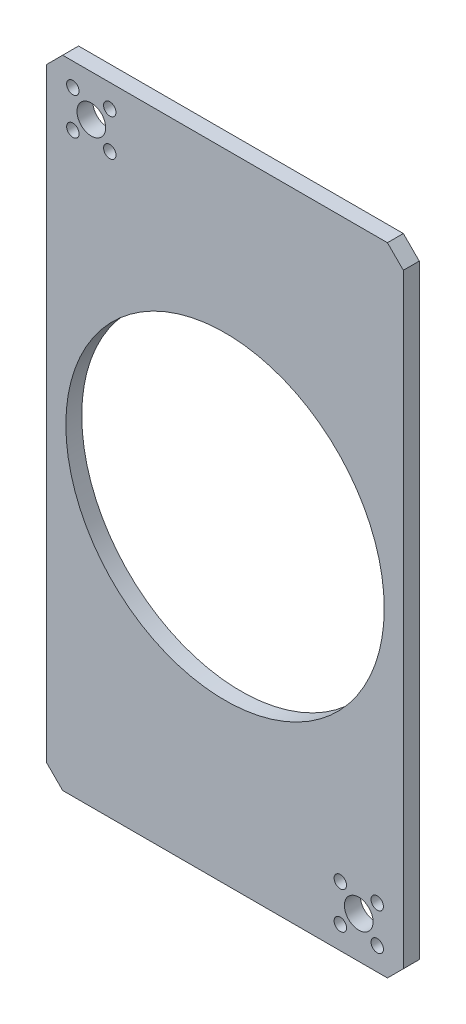
from build123d import *

# Parameters (mm, degrees)
SKETCH1_W               = 112
SKETCH1_H               = 200
BOSS_EXTRUDE1_DEPTH     = 5
SKETCH6_R               = 4.5
SKETCH6_R_2             = 1.95
LEANDUT_HOLES_DEPTH     = 115.721401665
CHAMFER1_SIZE           = 5
SKETCH7_R               = 50
CUT_EXTRUDE3_DEPTH      = 115.721401665
DELETEFACE1_OUTLINE_R   = 1.95
DELETEFACE1_OUTLINE_R_2 = 4.5
DELETEFACE1_DEPTH       = 5


# Read off the part's stored shape, not the designer's step: DeleteFace1
with BuildPart() as part:
    # Sketch1 → Boss-Extrude1 (new body)
    with BuildSketch(Plane.XY):
        Rectangle(SKETCH1_W, SKETCH1_H)
    extrude(amount=BOSS_EXTRUDE1_DEPTH)

    # Sketch6 → Leandut_holes (cut, through all)
    with BuildSketch(Plane.XY.offset(5)):
        with Locations((-42, 87)):
            Circle(SKETCH6_R)
        with Locations((-47.8, 92.8)):
            Circle(SKETCH6_R_2)
        with Locations(Location((-47.8, 81.2, 0), (0, 0, 180))):
            Circle(SKETCH6_R_2)
        with Locations((-36.2, 81.2)):
            Circle(SKETCH6_R_2)
        with Locations(Location((-36.2, 92.8, 0), (0, 0, 180))):
            Circle(SKETCH6_R_2)
        with Locations((36.2, 92.8)):
            Circle(SKETCH6_R_2)
        with Locations(Location((36.2, 81.2, 0), (0, 0, 180))):
            Circle(SKETCH6_R_2)
        with Locations((47.8, 81.2)):
            Circle(SKETCH6_R_2)
        with Locations(Location((47.8, 92.8, 0), (0, 0, 180))):
            Circle(SKETCH6_R_2)
        with Locations(Location((42, 87, 0), (0, 0, 180))):
            Circle(SKETCH6_R)
        with Locations((42, -87)):
            Circle(SKETCH6_R)
        with Locations((47.8, -92.8)):
            Circle(SKETCH6_R_2)
        with Locations(Location((47.8, -81.2, 0), (0, 0, 180))):
            Circle(SKETCH6_R_2)
        with Locations((36.2, -81.2)):
            Circle(SKETCH6_R_2)
        with Locations(Location((36.2, -92.8, 0), (0, 0, 180))):
            Circle(SKETCH6_R_2)
        with Locations((-36.2, -92.8)):
            Circle(SKETCH6_R_2)
        with Locations(Location((-36.2, -81.2, 0), (0, 0, 180))):
            Circle(SKETCH6_R_2)
        with Locations((-47.8, -81.2)):
            Circle(SKETCH6_R_2)
        with Locations(Location((-47.8, -92.8, 0), (0, 0, 180))):
            Circle(SKETCH6_R_2)
        with Locations(Location((-42, -87, 0), (0, 0, 180))):
            Circle(SKETCH6_R)
    extrude(amount=-LEANDUT_HOLES_DEPTH, mode=Mode.SUBTRACT)

    # Chamfer1
    chamfer1_edges = [part.edges().sort_by_distance(p)[0] for p in [
        (56, -100, 2.5),
        (-56, -100, 2.5),
        (-56, 100, 2.5),
        (56, 100, 2.5),
    ]]
    chamfer(chamfer1_edges, length=CHAMFER1_SIZE)

    # Sketch7 → Cut-Extrude3 (cut, through all)
    with BuildSketch(Plane.XY.offset(5)):
        Circle(SKETCH7_R)
    extrude(amount=-CUT_EXTRUDE3_DEPTH, mode=Mode.SUBTRACT)

    # DeleteFace1 outline → DeleteFace1 (add)
    with BuildSketch(Plane.XY):
        with Locations((-47.8, -81.2)):
            Circle(DELETEFACE1_OUTLINE_R)
        with Locations((-47.8, -92.8)):
            Circle(DELETEFACE1_OUTLINE_R)
        with Locations((-42, -87)):
            Circle(DELETEFACE1_OUTLINE_R_2)
        with Locations((36.2, 92.8)):
            Circle(DELETEFACE1_OUTLINE_R)
        with Locations((36.2, 81.2)):
            Circle(DELETEFACE1_OUTLINE_R)
        with Locations((47.8, 81.2)):
            Circle(DELETEFACE1_OUTLINE_R)
        with Locations((47.8, 92.8)):
            Circle(DELETEFACE1_OUTLINE_R)
        with Locations((-36.2, -81.2)):
            Circle(DELETEFACE1_OUTLINE_R)
        with Locations((-36.2, -92.8)):
            Circle(DELETEFACE1_OUTLINE_R)
        with Locations((42, 87)):
            Circle(DELETEFACE1_OUTLINE_R_2)
    extrude(amount=DELETEFACE1_DEPTH)


solid = part.part
